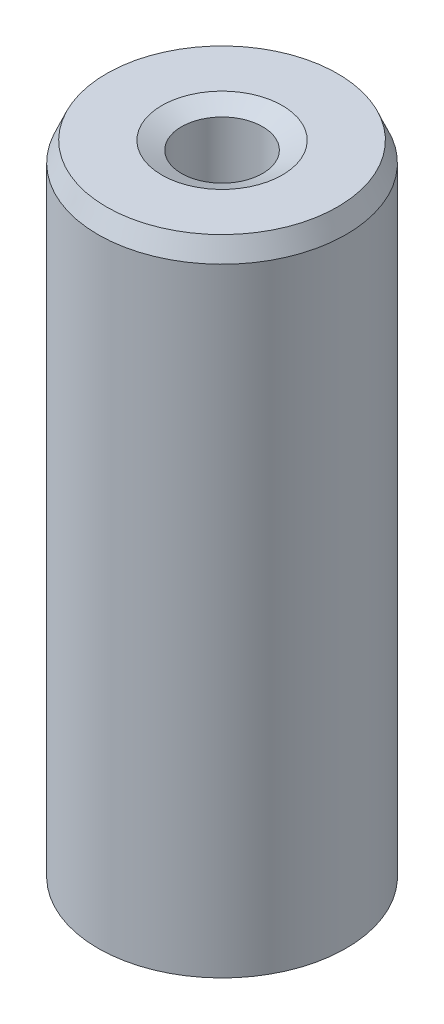
from build123d import *
from OCP.BRepFilletAPI import BRepFilletAPI_MakeChamfer

# Parameters (mm, degrees)
SKETCH1_R           = 5
BOSS_EXTRUDE1_DEPTH = 26.053671458
SKETCH2_R           = 1.635056568
CUT_EXTRUDE1_DEPTH  = 27.996181145
CHAMFER1_SIZE       = 0.793499241
CHAMFER1_SIZE2      = 0.342458072


with BuildPart() as part:
    # Sketch1 → Boss-Extrude1 (new body)
    with BuildSketch(Plane(origin=(0, 0, 0), x_dir=(1, 0, 0), z_dir=(0, 1, 0))):
        Circle(SKETCH1_R)
    extrude(amount=BOSS_EXTRUDE1_DEPTH)

    # Sketch2 → Cut-Extrude1 (cut, through all)
    with BuildSketch(Plane(origin=(0, 0, 0), x_dir=(1, 0, 0), z_dir=(0, 1, 0))):
        Circle(SKETCH2_R)
    extrude(amount=CUT_EXTRUDE1_DEPTH, mode=Mode.SUBTRACT)

    # Chamfer1: one chamfer whose edges measure the first distance from different faces: ONE call of the kernel's chamfer builder (chamfer() names one face for all edges)
    chamfer1_edges_1 = [part.edges().sort_by_distance(p)[0] for p in [
        (-1.635056568, 26.053671458, 0),
    ]]
    chamfer1_side_1 = [part.faces().sort_by_distance(p)[0] for p in [
        (-4.858578644, 26.053671458, 0),
    ]]
    chamfer1_edges_2 = [part.edges().sort_by_distance(p)[0] for p in [
        (-1.635056568, 0, 0),
    ]]
    chamfer1_side_2 = [part.faces().sort_by_distance(p)[0] for p in [
        (-1.635056568, 13.026835729, 0),
    ]]
    chamfer1_edges_3 = [part.edges().sort_by_distance(p)[0] for p in [
        (-5, 0, 0),
    ]]
    chamfer1_side_3 = [part.faces().sort_by_distance(p)[0] for p in [
        (-4.858578644, 0, 0),
    ]]
    chamfer1_edges_4 = [part.edges().sort_by_distance(p)[0] for p in [
        (-5, 26.053671458, 0),
    ]]
    chamfer1_side_4 = [part.faces().sort_by_distance(p)[0] for p in [
        (-5, 13.026835729, 0),
    ]]
    chamfer1 = BRepFilletAPI_MakeChamfer(part.part.solid().wrapped)
    for e in chamfer1_edges_1:
        chamfer1.Add(CHAMFER1_SIZE, CHAMFER1_SIZE2, e.wrapped, chamfer1_side_1[0].wrapped)  # the first distance lies on this face
    for e in chamfer1_edges_2:
        chamfer1.Add(CHAMFER1_SIZE, CHAMFER1_SIZE2, e.wrapped, chamfer1_side_2[0].wrapped)  # the first distance lies on this face
    for e in chamfer1_edges_3:
        chamfer1.Add(CHAMFER1_SIZE, CHAMFER1_SIZE2, e.wrapped, chamfer1_side_3[0].wrapped)  # the first distance lies on this face
    for e in chamfer1_edges_4:
        chamfer1.Add(CHAMFER1_SIZE, CHAMFER1_SIZE2, e.wrapped, chamfer1_side_4[0].wrapped)  # the first distance lies on this face
    add(Compound.cast(chamfer1.Shape()), mode=Mode.REPLACE)


solid = part.part
